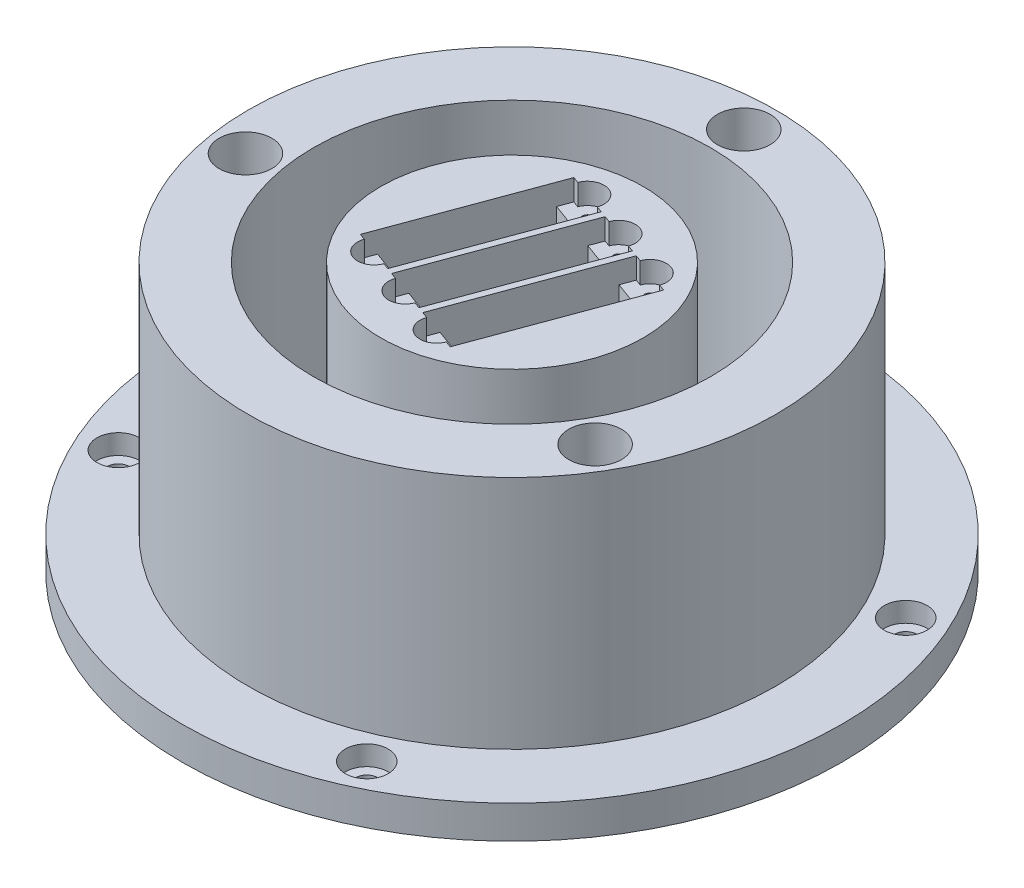
from build123d import *

# Parameters (mm, degrees)
SKETCH1_R                      = 40
SKETCH1_R_2                    = 4.3
SKETCH1_R_3                    = 30.1
SKETCH1_R_4                    = 4
BOSS_EXTRUDE1_DEPTH            = 39.7
CUT_EXTRUDE2_OUTLINE_R         = 4
CUT_EXTRUDE2_DEPTH             = 11
SKETCH2_R                      = 40
BOSS_EXTRUDE2_DEPTH            = 1
SKETCH3_R                      = 19.9
BOSS_EXTRUDE3_DEPTH            = 40.7
CUT_EXTRUDE3_DEPTH             = 3.2
CUT_EXTRUDE4_DEPTH             = 10
SKETCH6_R                      = 17.9
CUT_EXTRUDE5_DEPTH             = 63.898728127
SKETCH7_R                      = 0.8
CUT_EXTRUDE6_DEPTH             = 68.869359802
BOSS_EXTRUDE4_START            = -5
SKETCH8_R                      = 50
SKETCH8_R_2                    = 40
BOSS_EXTRUDE4_DEPTH            = 5
CBORE_FOR_M3_SHCS1_D           = 3.4
CBORE_FOR_M3_SHCS1_DEPTH       = 5
CBORE_FOR_M3_SHCS1_CBORE_D     = 6.5
CBORE_FOR_M3_SHCS1_CBORE_DEPTH = 3
CBORE_FOR_M3_SHCS1_TIP         = 1.021463052


# Read off the part's stored shape, not the designer's step: Cut-Extrude2
with BuildPart() as part:
    # Sketch1 → Boss-Extrude1 (new body)
    # profile 1 of 7: a face of its own
    with BuildSketch(Plane.XZ.offset(96.9)):
        with Locations(Location((0, 0, 0), (0, 0, 180))):
            Circle(SKETCH1_R)
        with Locations((0.154088268, -34.99966081)):
            Circle(SKETCH1_R_2, mode=Mode.SUBTRACT)
        with Locations((-34.494694465, 5.925879997)):
            Circle(SKETCH1_R_2, mode=Mode.SUBTRACT)
        with Locations((30.233551251, 17.63327476)):
            Circle(SKETCH1_R_2, mode=Mode.SUBTRACT)
        with Locations(Location((0, 0, 0), (0, 0, 180))):
            Circle(SKETCH1_R_3, mode=Mode.SUBTRACT)
    # profile 2 of 7: a face of its own
    with BuildSketch(Plane.XZ.offset(96.9)):
        with Locations((30.233551251, 17.63327476)):
            Circle(SKETCH1_R_2)
        with Locations((30.233551251, 17.63327476)):
            Circle(SKETCH1_R_4, mode=Mode.SUBTRACT)
    # profile 3 of 7: a face of its own
    with BuildSketch(Plane.XZ.offset(96.9)):
        with Locations((30.233551251, 17.63327476)):
            Circle(SKETCH1_R_4)
    # profile 4 of 7: a face of its own
    with BuildSketch(Plane.XZ.offset(96.9)):
        with Locations((-34.494694465, 5.925879997)):
            Circle(SKETCH1_R_2)
        with Locations((-34.494694465, 5.925879997)):
            Circle(SKETCH1_R_4, mode=Mode.SUBTRACT)
    # profile 5 of 7: a face of its own
    with BuildSketch(Plane.XZ.offset(96.9)):
        with Locations((-34.494694465, 5.925879997)):
            Circle(SKETCH1_R_4)
    # profile 6 of 7: a face of its own
    with BuildSketch(Plane.XZ.offset(96.9)):
        with Locations((0.154088268, -34.99966081)):
            Circle(SKETCH1_R_2)
        with Locations((0.154088268, -34.99966081)):
            Circle(SKETCH1_R_4, mode=Mode.SUBTRACT)
    # profile 7 of 7: a face of its own
    with BuildSketch(Plane.XZ.offset(96.9)):
        with Locations((0.154088268, -34.99966081)):
            Circle(SKETCH1_R_4)
    extrude(amount=BOSS_EXTRUDE1_DEPTH)

    # Cut-Extrude2 outline → Cut-Extrude2 (cut)
    with BuildSketch(Plane.XZ.offset(96.9)):
        with Locations((30.233551251, 17.63327476)):
            Circle(CUT_EXTRUDE2_OUTLINE_R)
        with Locations((0.154088268, -34.99966081)):
            Circle(CUT_EXTRUDE2_OUTLINE_R)
        with Locations((-34.494694465, 5.925879997)):
            Circle(CUT_EXTRUDE2_OUTLINE_R)
    extrude(amount=CUT_EXTRUDE2_DEPTH, mode=Mode.SUBTRACT)

    # Sketch2 → Boss-Extrude2 (add)
    with BuildSketch(Plane.XZ.offset(136.6)):
        Circle(SKETCH2_R)
    extrude(amount=BOSS_EXTRUDE2_DEPTH)

    # Sketch3 → Boss-Extrude3 (add)
    with BuildSketch(Plane.XZ.offset(137.6)):
        Circle(SKETCH3_R)
    extrude(amount=-BOSS_EXTRUDE3_DEPTH)

    # Sketch4 → Cut-Extrude3 (cut)
    with BuildSketch(Plane(origin=(0, -96.9, 0), x_dir=(1, 0, 0), z_dir=(0, 1, 0))):
        with BuildLine():
            Line((-5.48759728, 15.460346086), (-6.425775043, 15.806499932))
            Line((-6.425775043, 15.806499932), (-15.152313504, -7.844961471))
            Line((-15.152313504, -7.844961471), (-14.214135741, -8.191115317))
            ThreePointArc((-14.214135741, -8.191115317), (-12.734075949, -11.401944339), (-9.523246927, -9.921884547))
            Line((-9.523246927, -9.921884547), (-8.585069164, -10.268038394))
            Line((-8.585069164, -10.268038394), (0.141469298, 13.383423009))
            Line((0.141469298, 13.383423009), (-0.796708465, 13.729576855))
            ThreePointArc((-0.796708465, 13.729576855), (-2.276768257, 16.940405878), (-5.48759728, 15.460346086))
        make_face()
        with BuildLine():
            Line((-6.708713638, -10.960346086), (-7.646891401, -10.61419224))
            Line((-7.646891401, -10.61419224), (1.079647061, 13.037269163))
            Line((1.079647061, 13.037269163), (2.017824824, 12.691115317))
            ThreePointArc((2.017824824, 12.691115317), (5.228653846, 14.171175109), (6.708713638, 10.960346086))
            Line((6.708713638, 10.960346086), (7.646891401, 10.61419224))
            Line((7.646891401, 10.61419224), (-1.079647061, -13.037269163))
            Line((-1.079647061, -13.037269163), (-2.017824824, -12.691115317))
            ThreePointArc((-2.017824824, -12.691115317), (-5.228653846, -14.171175109), (-6.708713638, -10.960346086))
        make_face()
        with BuildLine():
            Line((6.425775043, -15.806499932), (5.48759728, -15.460346086))
            ThreePointArc((5.48759728, -15.460346086), (2.276768257, -16.940405878), (0.796708465, -13.729576855))
            Line((0.796708465, -13.729576855), (-0.141469298, -13.383423009))
            Line((-0.141469298, -13.383423009), (8.585069164, 10.268038394))
            Line((8.585069164, 10.268038394), (9.523246927, 9.921884547))
            ThreePointArc((9.523246927, 9.921884547), (12.734075949, 11.401944339), (14.214135741, 8.191115317))
            Line((14.214135741, 8.191115317), (15.152313504, 7.844961471))
            Line((15.152313504, 7.844961471), (6.425775043, -15.806499932))
        make_face()
    extrude(amount=-CUT_EXTRUDE3_DEPTH, mode=Mode.SUBTRACT)

    # Sketch5 → Cut-Extrude4 (cut)
    with BuildSketch(Plane(origin=(0, -100.1, 0), x_dir=(1, 0, 0), z_dir=(0, 1, 0))):
        Polygon((14.446159658, 5.931078834), (7.878915318, 8.354155757), (0.564684548, -11.469540373), (7.131928889, -13.892617296), align=None)
        Polygon((-7.131928889, 13.892617296), (-14.446159658, -5.931078834), (-7.878915318, -8.354155757), (-0.564684548, 11.469540373), align=None)
        Polygon((-0.373493214, -11.123386527), (6.940737555, 8.700309603), (0.373493214, 11.123386527), (-6.940737555, -8.700309603), align=None)
    extrude(amount=-CUT_EXTRUDE4_DEPTH, mode=Mode.SUBTRACT)

    # Sketch6 → Cut-Extrude5 (cut, through all)
    with BuildSketch(Plane(origin=(0, -110.1, 0), x_dir=(1, 0, 0), z_dir=(0, 1, 0))):
        with Locations(Location((0, 0, 0), (0, 0, 270))):
            Circle(SKETCH6_R)
    extrude(amount=-CUT_EXTRUDE5_DEPTH, mode=Mode.SUBTRACT)

    # Sketch7 → Cut-Extrude6 (cut, through all)
    with BuildSketch(Plane(origin=(0, -100.1, 0), x_dir=(1, 0, 0), z_dir=(0, 1, 0))):
        with Locations(Location((3.142152872, -14.594961471, 0), (0, 0, 180))):
            Circle(SKETCH7_R)
        with Locations(Location((-4.363269231, -11.825730701, 0), (0, 0, 180))):
            Circle(SKETCH7_R)
        with Locations(Location((-11.868691334, -9.056499932, 0), (0, 0, 180))):
            Circle(SKETCH7_R)
        with Locations(Location((-3.142152872, 14.594961471, 0), (0, 0, 180))):
            Circle(SKETCH7_R)
        with Locations(Location((4.363269231, 11.825730701, 0), (0, 0, 180))):
            Circle(SKETCH7_R)
        with Locations(Location((11.868691334, 9.056499932, 0), (0, 0, 180))):
            Circle(SKETCH7_R)
    extrude(amount=-CUT_EXTRUDE6_DEPTH, mode=Mode.SUBTRACT)

    # Sketch8 → Boss-Extrude4 (add)
    with BuildSketch(Plane.XZ.offset(137.6).offset(BOSS_EXTRUDE4_START)):
        Circle(SKETCH8_R)
        Circle(SKETCH8_R_2, mode=Mode.SUBTRACT)
    extrude(amount=BOSS_EXTRUDE4_DEPTH)

    # CBORE for M3 SHCS1
    with Locations(Plane(origin=(0, -132.6, 0), x_dir=(1, 0, 0), z_dir=(0, 1, 0))):
        with Locations((-40.867181552, -18.838085677), (-18.838085677, 40.867181552), (40.867181552, 18.838085677), (18.838085677, -40.867181552)):
            CounterBoreHole(CBORE_FOR_M3_SHCS1_D / 2, CBORE_FOR_M3_SHCS1_CBORE_D / 2, CBORE_FOR_M3_SHCS1_CBORE_DEPTH, depth=CBORE_FOR_M3_SHCS1_DEPTH)
            with Locations((0, 0, -(CBORE_FOR_M3_SHCS1_DEPTH + CBORE_FOR_M3_SHCS1_TIP / 2))):  # 118° drill point
                Cone(0, CBORE_FOR_M3_SHCS1_D / 2, CBORE_FOR_M3_SHCS1_TIP, mode=Mode.SUBTRACT)


solid = part.part
